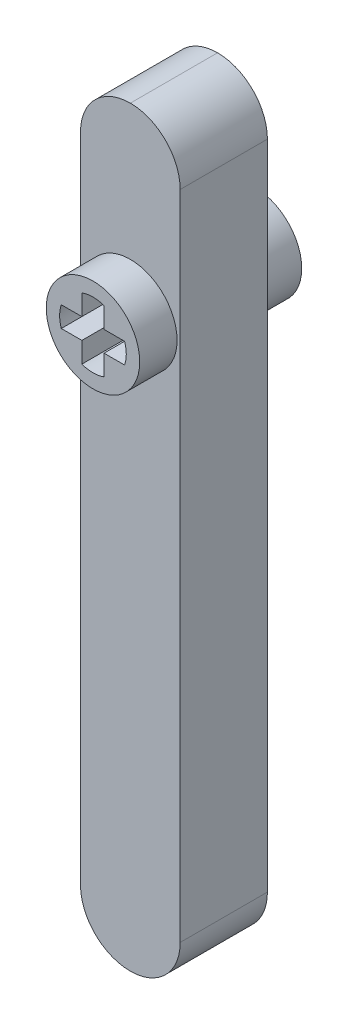
from build123d import *

# Parameters (mm, degrees)
BOSS_EXTRUDE1_DEPTH      = 7
FILLET1_R                = 4
BOSS_EXTRUDE2_DEPTH      = 3
BOSS_EXTRUDE2_DEPTH_BACK = 9.99999997
SKETCH2_R                = 3.75
CUT_EXTRUDE1_DEPTH       = 38.480069693


with BuildPart() as part:
    # Sketch1 → Boss-Extrude1 (new body)
    with BuildSketch(Plane.XY):
        Polygon((4, 25.4), (4, 34.925), (-4, 34.925), (-4, 25.4), (-4, -25.4), (4, -25.4), align=None)
    extrude(amount=BOSS_EXTRUDE1_DEPTH)

    # Fillet1
    fillet1_edges = [part.edges().sort_by_distance(p)[0] for p in [
        (-4, -25.4, 3.5),
        (4, -25.4, 3.5),
        (4, 34.925, 3.5),
        (-4, 34.925, 3.5),
    ]]
    fillet(fillet1_edges, radius=FILLET1_R - 0.0001)  # a hair under: the kernel refuses the full size

    # Sketch2 → Boss-Extrude2 (add, two sides: drawn at the far end of the back side and taken through both)
    with BuildSketch(Plane.XY.offset(7).offset(-BOSS_EXTRUDE2_DEPTH_BACK)):
        with Locations((0, 20.32)):
            Circle(SKETCH2_R)
    extrude(amount=BOSS_EXTRUDE2_DEPTH + BOSS_EXTRUDE2_DEPTH_BACK)

    # Sketch3 → Cut-Extrude1 (cut, through all)
    with BuildSketch(Plane(origin=(0, 0, -2.99999997), x_dir=(-1, 0, 0), z_dir=(0, 0, -1))):
        with BuildLine():
            Line((-0.889, 21.1455), (-0.889, 22.7965))
            ThreePointArc((-0.889, 22.7965), (0, 22.953207345), (0.889, 22.7965))
            Line((0.889, 22.7965), (0.889, 21.1455))
            Line((0.889, 21.1455), (2.54, 21.1455))
            ThreePointArc((2.54, 21.1455), (2.674528493, 20.32), (2.54, 19.4945))
            Line((2.54, 19.4945), (0.889, 19.4945))
            Line((0.889, 19.4945), (0.889, 17.8435))
            ThreePointArc((0.889, 17.8435), (0, 17.686792655), (-0.889, 17.8435))
            Line((-0.889, 17.8435), (-0.889, 19.4945))
            Line((-0.889, 19.4945), (-2.54, 19.4945))
            ThreePointArc((-2.54, 19.4945), (-2.674528493, 20.32), (-2.54, 21.1455))
            Line((-2.54, 21.1455), (-0.889, 21.1455))
        make_face()
    extrude(amount=-CUT_EXTRUDE1_DEPTH, mode=Mode.SUBTRACT)


solid = part.part
